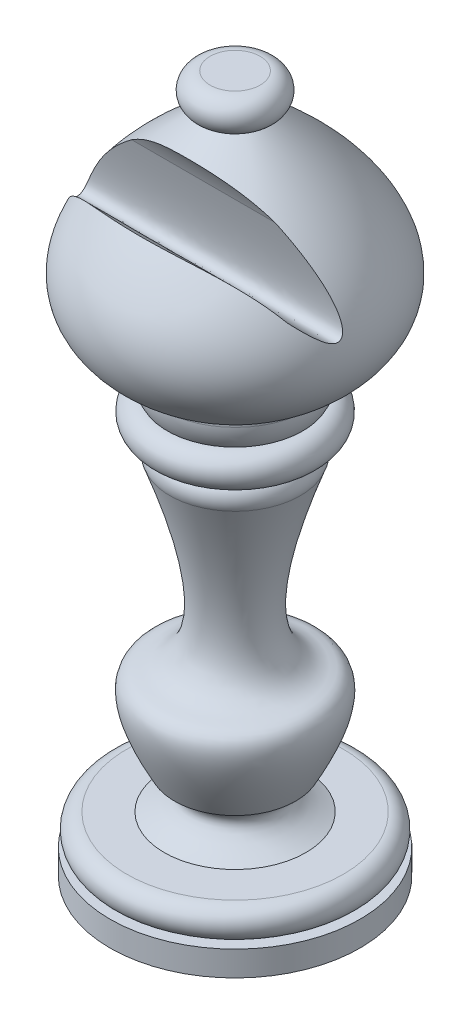
from build123d import *

# Parameters (mm, degrees)
SKETCH1_R               = 15
BOSS_EXTRUDE1_DEPTH     = 3
CUT_EXTRUDE1_DEPTH      = 85.628193936
CUT_EXTRUDE1_DEPTH_BACK = 85.628193936
FILLET1_R               = 5


with BuildPart() as part:
    # Sketch1 → Boss-Extrude1 (new body)
    with BuildSketch(Plane(origin=(0, 0, 0), x_dir=(1, 0, 0), z_dir=(0, 1, 0))):
        with Locations(Location((0, 0, 0), (0, 0, 270))):
            Circle(SKETCH1_R)
    extrude(amount=BOSS_EXTRUDE1_DEPTH)

    # Sketch2 → Revolve1 (revolve)
    with BuildSketch(Plane.XY):
        with BuildLine():
            Line((13, 3), (0, 3))
            Line((0, 3), (0, 11.407227642))
            Line((0, 11.407227642), (7.274140372, 11.407227642))
            add(Edge.make_bspline(
                [(8.499433611, 6.672811029), (2.782551189, 9.102648565), (7.274140372, 11.407227642)],
                knots=[0, 0, 0, 1, 1, 1], degree=2))
            Line((8.499433611, 6.672811029), (13, 6.672811029))
            ThreePointArc((13, 6.672811029), (14.836405515, 4.836405515), (13, 3))
        make_face()
    revolve(axis=Axis((0, 0, 0), (0, 1, 0)))

    # Sketch3 → Revolve2 (revolve)
    with BuildSketch(Plane.XY, mode=Mode.PRIVATE) as revolve2_sk:
        with BuildLine():
            Line((7.274140372, 11.407227642), (0, 11.407227642))
            Line((0, 11.407227642), (0, 53.285011329))
            Line((0, 53.285011329), (8.823939623, 53.285011329))
            Line((8.823939623, 53.285011329), (8.823939623, 50.296030031))
            Line((8.823939623, 50.296030031), (8.126253909, 50.296030031))
            ThreePointArc((8.126253909, 50.296030031), (10.126253909, 48.296030031), (8.126253909, 46.296030031))
            Line((8.126253909, 46.296030031), (6.033484578, 46.296030031))
            ThreePointArc((6.033484578, 46.296030031), (7.730320881, 45.354683213), (7.82984573, 43.416776591))
            add(Edge.make_bspline(
                [(7.82984573, 43.416776591), (0.485845428, 23.201312227), (12.432161101, 20.943774518), (7.274140372, 11.407227642)],
                knots=[0, 0, 0, 0.660085058, 1, 1, 1], degree=2))
        make_face()
    revolve(revolve2_sk.sketch.rotate(Axis((0, 0, 0), (0, 1, 0)), 90), axis=Axis((0, 0, 0), (0, 1, 0)))

    # Sketch4 → Revolve3 (revolve)
    with BuildSketch(Plane(origin=(0, 0, 0), x_dir=(0, 0, -1), z_dir=(1, 0, 0))):
        with BuildLine():
            Line((0, 53.285011329), (8.823939623, 53.285011329))
            add(Edge.make_bspline(
                [(0, 81.538732353), (26.759670813, 63.283858911), (8.823939623, 53.285011329)],
                knots=[0, 0, 0, 1, 1, 1], degree=2))
            Line((0, 81.538732353), (0, 53.285011329))
        make_face()
    revolve(axis=Axis((0, 53.285011329, 0), (0, 1, 0)))

    # Sketch5 → Cut-Extrude1 (cut, two sides: drawn at the far end of the back side and taken through both)
    with BuildSketch(Plane(origin=(0, 0, 0), x_dir=(0, 0, -1), z_dir=(1, 0, 0)).offset(-CUT_EXTRUDE1_DEPTH_BACK)):
        with BuildLine():
            Line((-19.900519696, 74.741541411), (-13.28702278, 82.319848293))
            add(Edge.make_bspline(
                [(-13.28702278, 82.319848293), (-6.414355472, 80.339788966), (-3.807570693, 74.097823451)],
                knots=[0, 0, 0, 1, 1, 1], degree=2))
            add(Edge.make_bspline(
                [(-6.805007666, 67.386258827), (0.222172111, 59.705631), (-3.807570693, 74.097823451)],
                knots=[0, 0, 0, 1, 1, 1], degree=2))
            add(Edge.make_bspline(
                [(-19.900519696, 74.741541411), (-11.675471636, 74.629954599), (-6.805007666, 67.386258827)],
                knots=[0, 0, 0, 1, 1, 1], degree=2))
        make_face()
    extrude(amount=CUT_EXTRUDE1_DEPTH + CUT_EXTRUDE1_DEPTH_BACK, mode=Mode.SUBTRACT)

    # Fillet1
    # the kernel refuses this fillet: 5 mm, written as the material it takes off along each edge
    with BuildSketch(Plane(origin=(0, 50.296030031, 0), x_dir=(0, 0, -1), z_dir=(1, 0, 0))) as fillet1_piece_1:
        with BuildLine():
            CenterArc((3.823939623, 2.547565856), FILLET1_R, 329.368592235, 30.631407765)
            Line((8.823939623, 2.547565856), (8.823939623, 0))
            Line((8.823939623, 0), (8.126253909, 0))
        make_face()
    revolve(axis=Axis((0, 50.296030031, 0), (0, 1, 0)), mode=Mode.SUBTRACT)

    # Sketch6 → Revolve4 (revolve)
    with BuildSketch(Plane.XY, mode=Mode.PRIVATE) as revolve4_sk:
        with BuildLine():
            Line((0, 79.670328894), (3, 79.670328894))
            ThreePointArc((3, 79.670328894), (5, 81.670328894), (3, 83.670328894))
            Line((3, 83.670328894), (0, 83.670328894))
            Line((0, 83.670328894), (0, 79.670328894))
        make_face()
    revolve(revolve4_sk.sketch.rotate(Axis((0, 0, 0), (0, 1, 0)), 90), axis=Axis((0, 0, 0), (0, 1, 0)))


solid = part.part
